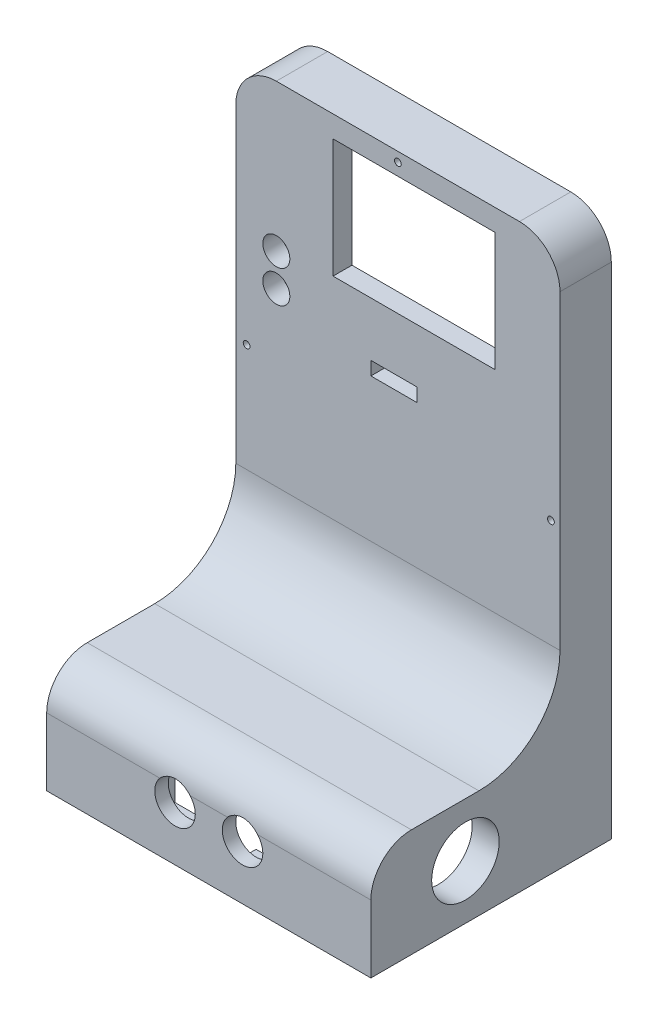
from build123d import *

# Parameters (mm, degrees)
ESQUISSE1_W                  = 120
ESQUISSE1_H                  = 200
BOSS_EXTRU_2_DEPTH           = 30
ESQUISSE3_W                  = 120
ESQUISSE3_H                  = 40
BOSS_EXTRU_3_DEPTH           = 70
CONG_1_R                     = 30
ESQUISSE4_W                  = 120
ESQUISSE4_H                  = 40
BOSS_EXTRU_4_DEPTH           = 140
CONG_2_R                     = 15
ESQUISSE5_W                  = 50
ESQUISSE5_H                  = 30
BOSS_EXTRU_9_DEPTH           = 7.5
ESQUISSE7_W                  = 100
ESQUISSE7_H                  = 65
ENL_V_MAT_EXTRU_1_DEPTH      = 35
ENL_V_MAT_EXTRU_7_REACH      = 358.791
ESQUISSE8_R                  = 7.5
ESQUISSE12_W                 = 45
ESQUISSE12_H                 = 20
ENL_V_MAT_EXTRU_8_DEPTH      = 5
ENL_V_MAT_EXTRU_9_DEPTH      = 289.617393793
ENL_V_MAT_EXTRU_9_DEPTH_BACK = 289.617393793
ESQUISSE13_R                 = 12.5
ESQUISSE14_W                 = 15
ESQUISSE14_H                 = 10
ENL_V_MAT_EXTRU_10_DEPTH     = 3
ESQUISSE20_W                 = 142.524843465
ESQUISSE20_H                 = 215.321289932
ENL_V_MAT_EXTRU_11_DEPTH     = 192
ESQUISSE21_W                 = 105
ESQUISSE21_H                 = 150
ENL_V_MAT_EXTRU_12_DEPTH     = 10
ENL_V_MAT_EXTRU_13_REACH     = 245.516
ESQUISSE22_W                 = 60
ESQUISSE22_H                 = 44
ENL_V_MAT_EXTRU_14_REACH     = 245.516
ESQUISSE23_W                 = 17
ESQUISSE23_H                 = 5
ENL_V_MAT_EXTRU_15_REACH     = 245.516
ESQUISSE24_R                 = 5
ESQUISSE25_W                 = 60
ESQUISSE25_H                 = 25
ENL_V_MAT_EXTRU_16_DEPTH     = 5
CONG_3_R                     = 15
ESQUISSE27_W                 = 76
ESQUISSE27_H                 = 44
ENL_V_MAT_EXTRU_18_DEPTH     = 13
ESQUISSE21_2_W               = 105
ESQUISSE21_2_H               = 150
ENL_V_MAT_EXTRU_20_DEPTH     = 20
ESQUISSE21_3_W               = 105
ESQUISSE21_3_H               = 150
ENL_V_MAT_EXTRU_21_DEPTH     = 22
ESQUISSE21_4_W               = 105
ESQUISSE21_4_H               = 150
ENL_V_MAT_EXTRU_22_DEPTH     = 23
ESQUISSE30_W                 = 70
ESQUISSE30_H                 = 7.5
ENL_V_MAT_EXTRU_23_DEPTH     = 11
ESQUISSE31_W                 = 11
ESQUISSE31_H                 = 200
ENL_V_MAT_EXTRU_24_DEPTH     = 254.771550896
ESQUISSE32_W                 = 6
ESQUISSE32_H                 = 7
ENL_V_MAT_EXTRU_25_DEPTH     = 2
ESQUISSE33_W                 = 8
ESQUISSE33_H                 = 10
ENL_V_MAT_EXTRU_26_DEPTH     = 6
ESQUISSE35_W                 = 22
ESQUISSE35_H                 = 12
ENL_V_MAT_EXTRU_27_DEPTH     = 2
ESQUISSE36_W                 = 10
ESQUISSE36_H                 = 9
ENL_V_MAT_EXTRU_28_DEPTH     = 4
ESQUISSE37_W                 = 25
ESQUISSE37_H                 = 10
ENL_V_MAT_EXTRU_29_DEPTH     = 2
ESQUISSE38_W                 = 12
ESQUISSE38_H                 = 3
ENL_V_MAT_EXTRU_30_DEPTH     = 4
ESQUISSE39_W                 = 70
ESQUISSE39_H                 = 4
ENL_V_MAT_EXTRU_31_DEPTH     = 10
ESQUISSE40_W                 = 70
ESQUISSE40_H                 = 14
ENL_V_MAT_EXTRU_32_DEPTH     = 5
ESQUISSE41_R                 = 1.25
ENL_V_MAT_EXTRU_33_DEPTH     = 15
ESQUISSE42_R                 = 1.25
ENL_V_MAT_EXTRU_34_DEPTH     = 250.641743388


with BuildPart() as part:
    # Esquisse1 → Boss.-Extru.2 (new, symmetric)
    with BuildSketch(Plane.XY):
        with Locations((60, 100)):
            Rectangle(ESQUISSE1_W, ESQUISSE1_H)
    extrude(amount=BOSS_EXTRU_2_DEPTH, both=True)

    # Esquisse3 → Boss.-Extru.3 (add)
    with BuildSketch(Plane.XY.offset(30)):
        with Locations((60, 20)):
            Rectangle(ESQUISSE3_W, ESQUISSE3_H)
    extrude(amount=BOSS_EXTRU_3_DEPTH)

    # Congé1
    cong_1_edges = [part.edges().sort_by_distance(p)[0] for p in [
        (60, 40, 30),
    ]]
    fillet(cong_1_edges, radius=CONG_1_R)

    # Esquisse4 → Boss.-Extru.4 (add)
    with BuildSketch(Plane(origin=(0, 0, -30), x_dir=(-1, 0, 0), z_dir=(0, 0, -1))):
        with Locations((-60, 20)):
            Rectangle(ESQUISSE4_W, ESQUISSE4_H)
    extrude(amount=BOSS_EXTRU_4_DEPTH)

    # Congé2
    cong_2_edges = [part.edges().sort_by_distance(p)[0] for p in [
        (60, 40, -30),
    ]]
    fillet(cong_2_edges, radius=CONG_2_R)

    # Esquisse5 → Boss.-Extru.9 (add)
    with BuildSketch(Plane.XY.offset(100)):
        with Locations((60, 20)):
            Rectangle(ESQUISSE5_W, ESQUISSE5_H)
    extrude(amount=-BOSS_EXTRU_9_DEPTH)

    # Esquisse7 → Enlèv. mat.-Extru.1 (cut)
    with BuildSketch(Plane.XZ):
        with Locations((60, 57.5)):
            Rectangle(ESQUISSE7_W, ESQUISSE7_H)
    extrude(amount=-ENL_V_MAT_EXTRU_1_DEPTH, mode=Mode.SUBTRACT)

    # Esquisse8 → Enlèv. mat.-Extru.7 (cut, up to next)
    with BuildSketch(Plane.XY.offset(100), mode=Mode.PRIVATE) as enl_v_mat_extru_7_sk1:
        with Locations((47.5, 20)):
            Circle(ESQUISSE8_R)
    enl_v_mat_extru_7_tool1 = extrude(enl_v_mat_extru_7_sk1.sketch, amount=-ENL_V_MAT_EXTRU_7_REACH, mode=Mode.PRIVATE) & part.part
    # Esquisse8 → Enlèv. mat.-Extru.7 (cut, up to next)
    with BuildSketch(Plane.XY.offset(100), mode=Mode.PRIVATE) as enl_v_mat_extru_7_sk2:
        with Locations((72.5, 20)):
            Circle(ESQUISSE8_R)
    enl_v_mat_extru_7_tool2 = extrude(enl_v_mat_extru_7_sk2.sketch, amount=-ENL_V_MAT_EXTRU_7_REACH, mode=Mode.PRIVATE) & part.part
    add(enl_v_mat_extru_7_tool1.solids().sort_by_distance((47.5, 20, 100))[0], mode=Mode.SUBTRACT)
    add(enl_v_mat_extru_7_tool2.solids().sort_by_distance((72.5, 20, 100))[0], mode=Mode.SUBTRACT)

    # Esquisse12 → Enlèv. mat.-Extru.8 (cut)
    with BuildSketch(Plane(origin=(0, 0, 90), x_dir=(-1, 0, 0), z_dir=(0, 0, -1))):
        with Locations((-60, 20)):
            Rectangle(ESQUISSE12_W, ESQUISSE12_H)
    extrude(amount=-ENL_V_MAT_EXTRU_8_DEPTH, mode=Mode.SUBTRACT)

    # Esquisse13 → Enlèv. mat.-Extru.9 (cut, two sides: drawn at the far end of the back side and taken through both)
    with BuildSketch(Plane(origin=(120, 0, 0), x_dir=(0, 0, -1), z_dir=(1, 0, 0)).offset(-ENL_V_MAT_EXTRU_9_DEPTH_BACK)):
        with Locations((-65, 20)):
            Circle(ESQUISSE13_R)
    extrude(amount=ENL_V_MAT_EXTRU_9_DEPTH + ENL_V_MAT_EXTRU_9_DEPTH_BACK, mode=Mode.SUBTRACT)

    # Esquisse14 → Enlèv. mat.-Extru.10 (cut)
    with BuildSketch(Plane(origin=(0, 0, 90), x_dir=(-1, 0, 0), z_dir=(0, 0, -1))):
        with Locations((-60, 5)):
            Rectangle(ESQUISSE14_W, ESQUISSE14_H)
    extrude(amount=-ENL_V_MAT_EXTRU_10_DEPTH, mode=Mode.SUBTRACT)

    # Esquisse20 → Enlèv. mat.-Extru.11 (cut)
    with BuildSketch(Plane.XY):
        with Locations((67.67012367, 99.581629618)):
            Rectangle(ESQUISSE20_W, ESQUISSE20_H)
    extrude(amount=-ENL_V_MAT_EXTRU_11_DEPTH, mode=Mode.SUBTRACT)

    # Esquisse21 → Enlèv. mat.-Extru.12 (cut)
    with BuildSketch(Plane(origin=(0, 0, 0), x_dir=(-1, 0, 0), z_dir=(0, 0, -1))):
        with Locations((-60, 117.5)):
            Rectangle(ESQUISSE21_W, ESQUISSE21_H)
    extrude(amount=-ENL_V_MAT_EXTRU_12_DEPTH, mode=Mode.SUBTRACT)

    # Esquisse22 → Enlèv. mat.-Extru.13 (cut, up to next)
    with BuildSketch(Plane.XY.offset(30), mode=Mode.PRIVATE) as enl_v_mat_extru_13_sk1:
        with Locations((66, 170)):
            Rectangle(ESQUISSE22_W, ESQUISSE22_H)
    enl_v_mat_extru_13_tool1 = extrude(enl_v_mat_extru_13_sk1.sketch, amount=-ENL_V_MAT_EXTRU_13_REACH, mode=Mode.PRIVATE) & part.part
    add(enl_v_mat_extru_13_tool1.solids().sort_by_distance((66, 170, 30))[0], mode=Mode.SUBTRACT)

    # Esquisse23 → Enlèv. mat.-Extru.14 (cut, up to next)
    with BuildSketch(Plane.XY.offset(30), mode=Mode.PRIVATE) as enl_v_mat_extru_14_sk1:
        with Locations((58.5, 125.5)):
            Rectangle(ESQUISSE23_W, ESQUISSE23_H)
    enl_v_mat_extru_14_tool1 = extrude(enl_v_mat_extru_14_sk1.sketch, amount=-ENL_V_MAT_EXTRU_14_REACH, mode=Mode.PRIVATE) & part.part
    add(enl_v_mat_extru_14_tool1.solids().sort_by_distance((58.5, 125.5, 30))[0], mode=Mode.SUBTRACT)

    # Esquisse24 → Enlèv. mat.-Extru.15 (cut, up to next)
    with BuildSketch(Plane.XY.offset(30), mode=Mode.PRIVATE) as enl_v_mat_extru_15_sk1:
        with Locations((15, 145.5)):
            Circle(ESQUISSE24_R)
    enl_v_mat_extru_15_tool1 = extrude(enl_v_mat_extru_15_sk1.sketch, amount=-ENL_V_MAT_EXTRU_15_REACH, mode=Mode.PRIVATE) & part.part
    # Esquisse24 → Enlèv. mat.-Extru.15 (cut, up to next)
    with BuildSketch(Plane.XY.offset(30), mode=Mode.PRIVATE) as enl_v_mat_extru_15_sk2:
        with Locations((15, 133.5)):
            Circle(ESQUISSE24_R)
    enl_v_mat_extru_15_tool2 = extrude(enl_v_mat_extru_15_sk2.sketch, amount=-ENL_V_MAT_EXTRU_15_REACH, mode=Mode.PRIVATE) & part.part
    add(enl_v_mat_extru_15_tool1.solids().sort_by_distance((15, 145.5, 30))[0], mode=Mode.SUBTRACT)
    add(enl_v_mat_extru_15_tool2.solids().sort_by_distance((15, 133.5, 30))[0], mode=Mode.SUBTRACT)

    # Esquisse25 → Enlèv. mat.-Extru.16 (cut)
    with BuildSketch(Plane(origin=(0, 0, 10), x_dir=(-1, 0, 0), z_dir=(0, 0, -1))):
        with Locations((-62.5, 95.5)):
            Rectangle(ESQUISSE25_W, ESQUISSE25_H)
    extrude(amount=-ENL_V_MAT_EXTRU_16_DEPTH, mode=Mode.SUBTRACT)

    # Congé3
    # the kernel refuses this fillet: 15 mm, written as the material it takes off along each edge
    with BuildSketch(Plane(origin=(157.5, 40, 100), x_dir=(0, 0, -1), z_dir=(-1, 0, 0))) as cong_3_piece_1:
        with BuildLine():
            CenterArc((CONG_3_R, CONG_3_R), CONG_3_R, 180, 90)
            Line((0, CONG_3_R), (0, 0))
            Line((0, 0), (CONG_3_R, 0))
        make_face()
    extrude(amount=195, mode=Mode.SUBTRACT)
    with BuildSketch(Plane(origin=(0, 200, 67.5), x_dir=(0, -1, 0), z_dir=(0, 0, -1))) as cong_3_piece_2:
        with BuildLine():
            CenterArc((CONG_3_R, -CONG_3_R), CONG_3_R, 90, 90)
            Line((0, -CONG_3_R), (0, 0))
            Line((0, 0), (CONG_3_R, 0))
        make_face()
    extrude(amount=105, mode=Mode.SUBTRACT)
    with BuildSketch(Plane(origin=(120, 200, -37.5), x_dir=(-1, 0, 0), z_dir=(0, 0, 1))) as cong_3_piece_3:
        with BuildLine():
            CenterArc((CONG_3_R, CONG_3_R), CONG_3_R, 180, 90)
            Line((0, CONG_3_R), (0, 0))
            Line((0, 0), (CONG_3_R, 0))
        make_face()
    extrude(amount=105, mode=Mode.SUBTRACT)

    # Esquisse27 → Enlèv. mat.-Extru.18 (cut)
    with BuildSketch(Plane(origin=(0, 0, 10), x_dir=(-1, 0, 0), z_dir=(0, 0, -1))):
        with Locations((-63, 170)):
            Rectangle(ESQUISSE27_W, ESQUISSE27_H)
    extrude(amount=-ENL_V_MAT_EXTRU_18_DEPTH, mode=Mode.SUBTRACT)

    # Esquisse21<2> → Enlèv. mat.-Extru.20 (cut)
    with BuildSketch(Plane(origin=(0, 0, 0), x_dir=(-1, 0, 0), z_dir=(0, 0, -1))):
        with Locations((-60, 117.5)):
            Rectangle(ESQUISSE21_2_W, ESQUISSE21_2_H)
    extrude(amount=-ENL_V_MAT_EXTRU_20_DEPTH, mode=Mode.SUBTRACT)

    # Esquisse21<3> → Enlèv. mat.-Extru.21 (cut)
    with BuildSketch(Plane(origin=(0, 0, 0), x_dir=(-1, 0, 0), z_dir=(0, 0, -1))):
        with Locations((-60, 117.5)):
            Rectangle(ESQUISSE21_3_W, ESQUISSE21_3_H)
    extrude(amount=-ENL_V_MAT_EXTRU_21_DEPTH, mode=Mode.SUBTRACT)

    # Esquisse21<4> → Enlèv. mat.-Extru.22 (cut)
    with BuildSketch(Plane(origin=(0, 0, 0), x_dir=(-1, 0, 0), z_dir=(0, 0, -1))):
        with Locations((-60, 117.5)):
            Rectangle(ESQUISSE21_4_W, ESQUISSE21_4_H)
    extrude(amount=-ENL_V_MAT_EXTRU_22_DEPTH, mode=Mode.SUBTRACT)

    # Esquisse30 → Enlèv. mat.-Extru.23 (cut)
    with BuildSketch(Plane.XZ.offset(-35)):
        with Locations((57.5, 28.75)):
            Rectangle(ESQUISSE30_W, ESQUISSE30_H)
    extrude(amount=-ENL_V_MAT_EXTRU_23_DEPTH, mode=Mode.SUBTRACT)

    # Esquisse31 → Enlèv. mat.-Extru.24 (cut, through all)
    with BuildSketch(Plane(origin=(0, 0, 0), x_dir=(0, 0, -1), z_dir=(1, 0, 0))):
        with Locations((-5.5, 100)):
            Rectangle(ESQUISSE31_W, ESQUISSE31_H)
    extrude(amount=ENL_V_MAT_EXTRU_24_DEPTH, mode=Mode.SUBTRACT)

    # Esquisse32 → Enlèv. mat.-Extru.25 (cut)
    with BuildSketch(Plane(origin=(0, 0, 23), x_dir=(-1, 0, 0), z_dir=(0, 0, -1))):
        with Locations((-35.5, 110)):
            Rectangle(ESQUISSE32_W, ESQUISSE32_H)
    extrude(amount=-ENL_V_MAT_EXTRU_25_DEPTH, mode=Mode.SUBTRACT)

    # Esquisse33 → Enlèv. mat.-Extru.26 (cut)
    with BuildSketch(Plane(origin=(0, 0, 23), x_dir=(-1, 0, 0), z_dir=(0, 0, -1))):
        with Locations((-45.5, 110)):
            Rectangle(ESQUISSE33_W, ESQUISSE33_H)
    extrude(amount=-ENL_V_MAT_EXTRU_26_DEPTH, mode=Mode.SUBTRACT)

    # Esquisse35 → Enlèv. mat.-Extru.27 (cut)
    with BuildSketch(Plane(origin=(0, 0, 23), x_dir=(-1, 0, 0), z_dir=(0, 0, -1))):
        with Locations((-32, 135.617217642)):
            Rectangle(ESQUISSE35_W, ESQUISSE35_H)
    extrude(amount=-ENL_V_MAT_EXTRU_27_DEPTH, mode=Mode.SUBTRACT)

    # Esquisse36 → Enlèv. mat.-Extru.28 (cut)
    with BuildSketch(Plane(origin=(0, 0, 23), x_dir=(-1, 0, 0), z_dir=(0, 0, -1))):
        with Locations((-32, 134.117217642)):
            Rectangle(ESQUISSE36_W, ESQUISSE36_H)
    extrude(amount=-ENL_V_MAT_EXTRU_28_DEPTH, mode=Mode.SUBTRACT)

    # Esquisse37 → Enlèv. mat.-Extru.29 (cut)
    with BuildSketch(Plane(origin=(0, 0, 23), x_dir=(-1, 0, 0), z_dir=(0, 0, -1))):
        with Locations((-77, 110)):
            Rectangle(ESQUISSE37_W, ESQUISSE37_H)
    extrude(amount=-ENL_V_MAT_EXTRU_29_DEPTH, mode=Mode.SUBTRACT)

    # Esquisse38 → Enlèv. mat.-Extru.30 (cut)
    with BuildSketch(Plane(origin=(0, 0, 23), x_dir=(-1, 0, 0), z_dir=(0, 0, -1))):
        with Locations((-38.790269329, 68)):
            Rectangle(ESQUISSE38_W, ESQUISSE38_H)
    extrude(amount=-ENL_V_MAT_EXTRU_30_DEPTH, mode=Mode.SUBTRACT)

    # Esquisse39 → Enlèv. mat.-Extru.31 (cut)
    with BuildSketch(Plane(origin=(0, 42.5, 0), x_dir=(1, 0, 0), z_dir=(0, 1, 0))):
        with Locations((57.5, -21)):
            Rectangle(ESQUISSE39_W, ESQUISSE39_H)
    extrude(amount=-ENL_V_MAT_EXTRU_31_DEPTH, mode=Mode.SUBTRACT)

    # Esquisse40 → Enlèv. mat.-Extru.32 (cut)
    with BuildSketch(Plane.XY.offset(25)):
        with Locations((57.5, 39)):
            Rectangle(ESQUISSE40_W, ESQUISSE40_H)
    extrude(amount=-ENL_V_MAT_EXTRU_32_DEPTH, mode=Mode.SUBTRACT)

    # Esquisse41 → Enlèv. mat.-Extru.33 (cut)
    with BuildSketch(Plane(origin=(0, 0, 11), x_dir=(-1, 0, 0), z_dir=(0, 0, -1))):
        with Locations(Location((-60, 20, 0), (0, 0, 90))):
            Circle(ESQUISSE41_R)
    extrude(amount=-ENL_V_MAT_EXTRU_33_DEPTH, mode=Mode.SUBTRACT)

    # Esquisse42 → Enlèv. mat.-Extru.34 (cut, through all)
    with BuildSketch(Plane(origin=(0, 0, 11), x_dir=(-1, 0, 0), z_dir=(0, 0, -1))):
        with Locations(Location((-116.651195727, 110, 0), (0, 0, 90))):
            Circle(ESQUISSE42_R)
        with Locations(Location((-4, 110, 0), (0, 0, 90))):
            Circle(ESQUISSE42_R)
        with Locations(Location((-60, 196.5, 0), (0, 0, 90))):
            Circle(ESQUISSE42_R)
    extrude(amount=-ENL_V_MAT_EXTRU_34_DEPTH, mode=Mode.SUBTRACT)


solid = part.part
